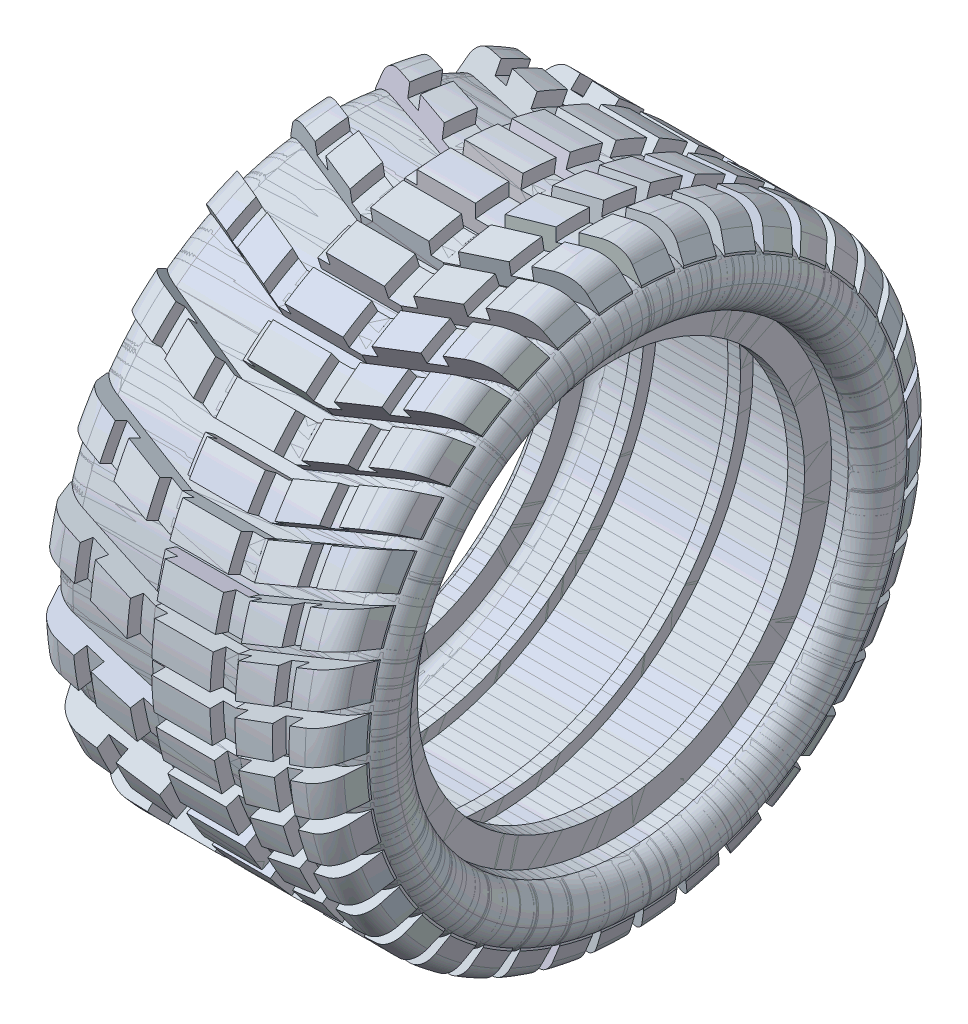
from build123d import *

# Parameters (mm, degrees)
BOSS_EXTRUDE1_REACH   = 99.036
CIRPATTERN1_COUNT     = 20
BODY_MOVE_COPY1_ANGLE = 9


with BuildPart() as part:
    # Sketch1 → Revolve1 (revolve)
    with BuildSketch(Plane.XY):
        with BuildLine():
            Line((-30.5, 25.5), (-30.5, 23.25))
            Line((-30.5, 23.25), (-32.5, 23.25))
            Line((-32.5, 23.25), (-32.5, 26.5))
            Line((-32.5, 26.5), (-34.5, 26.5))
            ThreePointArc((-34.5, 26.5), (-36.686729039, 30.480939803), (-33.186729039, 33.37570501))
            Line((-33.186729039, 33.37570501), (-1.313270961, 33.37570501))
            ThreePointArc((-1.313270961, 33.37570501), (2.186729039, 30.480939803), (0, 26.5))
            Line((0, 26.5), (-2, 26.5))
            Line((-2, 26.5), (-2, 23.25))
            Line((-2, 23.25), (-4, 23.25))
            Line((-4, 23.25), (-4, 25.5))
            Line((-4, 25.5), (-4, 25.927842744))
            Line((-4, 25.927842744), (-1.878679656, 28.049163087))
            Line((-1.878679656, 28.049163087), (-1.313270961, 28.049163087))
            ThreePointArc((-1.313270961, 28.049163087), (0.45, 29.812434049), (-1.313270961, 31.57570501))
            Line((-1.313270961, 31.57570501), (-5, 31.57570501))
            Line((-5, 31.57570501), (-5, 30.07570501))
            Line((-5, 30.07570501), (-6.5, 30.07570501))
            Line((-6.5, 30.07570501), (-6.5, 31.57570501))
            Line((-6.5, 31.57570501), (-16.5, 31.57570501))
            Line((-16.5, 31.57570501), (-16.5, 30.07570501))
            Line((-16.5, 30.07570501), (-18, 30.07570501))
            Line((-18, 30.07570501), (-18, 31.57570501))
            Line((-18, 31.57570501), (-28, 31.57570501))
            Line((-28, 31.57570501), (-28, 30.07570501))
            Line((-28, 30.07570501), (-29.5, 30.07570501))
            Line((-29.5, 30.07570501), (-29.5, 31.57570501))
            Line((-29.5, 31.57570501), (-33.186729039, 31.57570501))
            ThreePointArc((-33.186729039, 31.57570501), (-34.95, 29.812434049), (-33.186729039, 28.049163087))
            Line((-33.186729039, 28.049163087), (-32.621320344, 28.049163087))
            Line((-32.621320344, 28.049163087), (-30.5, 25.927842744))
            Line((-30.5, 25.927842744), (-30.5, 25.5))
        make_face()
    revolve(axis=Axis((0, 0, 0), (-1, 0, 0)))

    # Sketch3 → Boss-Extrude1 (add, up to next)
    with BuildSketch(Plane(origin=(0, 50, 0), x_dir=(-1, 0, 0), z_dir=(0, 1, 0)), mode=Mode.PRIVATE) as boss_extrude1_sk1:
        Polygon((22.25, 4.5), (12.25, 4.5), (-1.25, -0.413598163), (-1.25, -4.413598163), (12.25, 0.5), (22.25, 0.5), align=None)
    boss_extrude1_tool1 = extrude(boss_extrude1_sk1.sketch, amount=-BOSS_EXTRUDE1_REACH, mode=Mode.PRIVATE) - part.part
    boss_extrude1 = boss_extrude1_tool1.solids().sort_by_distance((-10.5, 50, 1.088647))[0]
    add(boss_extrude1)

    # CirPattern1: Boss-Extrude1 ×20 about axis
    cirpattern1_axis = Axis((0, 0, 0), (1, 0, 0))
    for i in range(1, CIRPATTERN1_COUNT):
        add(boss_extrude1.rotate(cirpattern1_axis, i * 360 / CIRPATTERN1_COUNT))

    # Sketch4 → Cut-Revolve2 (revolve, cut)
    with BuildSketch(Plane.XY):
        with BuildLine():
            Line((-35.95, 32.062152595), (-34.95, 34.507499115))
            ThreePointArc((-34.95, 34.507499115), (-33.845543211, 35.862603921), (-32.173212302, 36.37195956))
            Line((-32.173212302, 36.37195956), (-30.25, 36.37195956))
            Line((-30.25, 36.37195956), (-30.25, 34.77195956))
            Line((-30.25, 34.77195956), (-28.25, 34.77195956))
            Line((-28.25, 34.77195956), (-28.25, 36.37195956))
            Line((-28.25, 36.37195956), (-23.75, 36.37195956))
            Line((-23.75, 36.37195956), (-23.75, 34.77195956))
            Line((-23.75, 34.77195956), (-20.75, 34.77195956))
            Line((-20.75, 34.77195956), (-20.75, 36.37195956))
            Line((-20.75, 36.37195956), (-13.75, 36.37195956))
            Line((-13.75, 36.37195956), (-13.75, 34.77195956))
            Line((-13.75, 34.77195956), (-10.75, 34.77195956))
            Line((-10.75, 34.77195956), (-10.75, 36.37195956))
            Line((-10.75, 36.37195956), (-6.25, 36.37195956))
            Line((-6.25, 36.37195956), (-6.25, 34.77195956))
            Line((-6.25, 34.77195956), (-4.25, 34.77195956))
            Line((-4.25, 34.77195956), (-4.25, 36.37195956))
            Line((-4.25, 36.37195956), (-2.326787698, 36.37195956))
            ThreePointArc((-2.326787698, 36.37195956), (-0.654456789, 35.862603921), (0.45, 34.507499115))
            Line((0.45, 34.507499115), (1.45, 32.062152595))
            Line((1.45, 32.062152595), (9.429049566, 56.504469474))
            Line((9.429049566, 56.504469474), (-43.929049566, 56.504469474))
            Line((-43.929049566, 56.504469474), (-35.95, 32.062152595))
        make_face()
    revolve(axis=Axis((-1.313270961, 0, 0), (-1, 0, 0)), mode=Mode.SUBTRACT)


with BuildPart() as body_2:
    # Body-Move/Copy1: copy of part
    add(part.part.rotate(Axis((0, 0, 0), (1, 0, 0)), BODY_MOVE_COPY1_ANGLE))


with BuildPart() as body_3:
    # Mirror2: mirrored copy
    add(body_2.part.mirror(Plane.ZY.offset(17.25)))


with BuildPart() as part_1:
    add(part.part)

    # Combine1: union body 3
    add(body_3.part)


solid = Compound([body_2.part, part_1.part])
